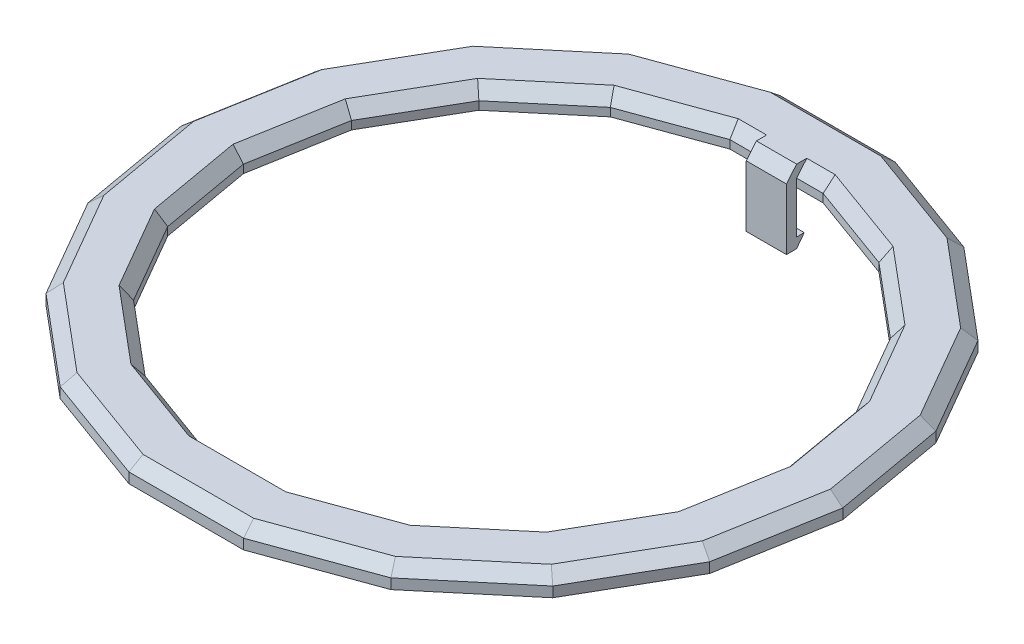
from build123d import *
from OCP.BRepFilletAPI import BRepFilletAPI_MakeChamfer

# Parameters (mm, degrees)
BOSS_EXTRUDE1_DEPTH = 1
BOSS_EXTRUDE3_DEPTH = 4
CUT_EXTRUDE2_DEPTH  = 1
BOSS_EXTRUDE5_DEPTH = 4
SKETCH6_W           = 10.5
SKETCH6_H           = 2
CUT_EXTRUDE3_DEPTH  = 1.25
SKETCH7_W           = 7.9
SKETCH7_H           = 14.4
BOSS_EXTRUDE6_DEPTH = 2
CHAMFER1_SIZE       = 2.383507185
CHAMFER1_SIZE_2     = 2
BOSS_EXTRUDE7_DEPTH = 7.9


with BuildPart() as part:
    # Sketch1 → Boss-Extrude1 (new body)
    with BuildSketch(Plane(origin=(0, 0, 0), x_dir=(1, 0, 0), z_dir=(0, 1, 0))):
        Polygon((62.969146776, 0), (59.171642563, 21.536716606), (48.237164976, 40.47578734), (31.484573388, 54.532880763), (10.934477587, 62.012503946), (-10.934477587, 62.012503946), (-31.484573388, 54.532880763), (-48.237164976, 40.47578734), (-59.171642563, 21.536716606), (-62.969146776, 0), (-59.171642563, -21.536716606), (-48.237164976, -40.47578734), (-31.484573388, -54.532880763), (-10.934477587, -62.012503946), (10.934477587, -62.012503946), (31.484573388, -54.532880763), (48.237164976, -40.47578734), (59.171642563, -21.536716606), align=None)
    extrude(amount=-BOSS_EXTRUDE1_DEPTH)

    # Sketch3 → Cut-Extrude2 (cut)
    with BuildSketch(Plane(origin=(0, 0, 0), x_dir=(1, 0, 0), z_dir=(0, 1, 0))):
        Polygon((54.814880655, 0), (51.509138861, 18.747793338), (41.990634726, 35.234326111), (27.407440327, 47.471079153), (9.518504135, 53.982119449), (-9.518504135, 53.982119449), (-27.407440328, 47.471079153), (-41.990634726, 35.234326111), (-51.509138861, 18.747793338), (-54.814880655, 0), (-51.509138861, -18.747793338), (-41.990634726, -35.234326111), (-27.407440327, -47.471079153), (-9.518504135, -53.982119449), (9.518504135, -53.982119449), (27.407440328, -47.471079153), (41.990634726, -35.234326111), (51.509138861, -18.747793338), align=None)
    extrude(amount=-CUT_EXTRUDE2_DEPTH, mode=Mode.SUBTRACT)


with BuildPart() as body_2:
    # Sketch1<7> → Boss-Extrude3 (new body)
    with BuildSketch(Plane(origin=(0, 0, 0), x_dir=(1, 0, 0), z_dir=(0, 1, 0))):
        Polygon((65, 0), (61.080020351, 22.231309316), (49.792888803, 41.78119463), (32.5, 56.291651246), (11.287131548, 64.012503946), (-11.287131548, 64.012503946), (-32.5, 56.291651246), (-49.792888803, 41.78119463), (-61.080020351, 22.231309316), (-65, 0), (-61.080020351, -22.231309316), (-49.792888803, -41.78119463), (-32.5, -56.291651246), (-11.287131548, -64.012503946), (11.287131548, -64.012503946), (32.5, -56.291651246), (49.792888803, -41.78119463), (61.080020351, -22.231309316), align=None)
        Polygon((62.969146776, 0), (59.171642563, 21.536716606), (48.237164976, 40.47578734), (31.484573388, 54.532880763), (10.934477587, 62.012503946), (-10.934477587, 62.012503946), (-31.484573388, 54.532880763), (-48.237164976, 40.47578734), (-59.171642563, 21.536716606), (-62.969146776, 0), (-59.171642563, -21.536716606), (-48.237164976, -40.47578734), (-31.484573388, -54.532880763), (-10.934477587, -62.012503946), (10.934477587, -62.012503946), (31.484573388, -54.532880763), (48.237164976, -40.47578734), (59.171642563, -21.536716606), align=None, mode=Mode.SUBTRACT)
    extrude(amount=-BOSS_EXTRUDE3_DEPTH)


    add(part.part)  # Boss-Extrude5 merges part
    # Sketch5 → Boss-Extrude5 (add)
    with BuildSketch(Plane(origin=(0, 0, 0), x_dir=(1, 0, 0), z_dir=(0, 1, 0))):
        Polygon((54.814880655, 0), (51.509138861, 18.747793338), (41.990634726, 35.234326111), (27.407440328, 47.471079153), (9.518504135, 53.982119449), (-9.518504135, 53.982119449), (-27.407440328, 47.471079153), (-41.990634726, 35.234326111), (-51.509138861, 18.747793338), (-54.814880655, 0), (-51.509138861, -18.747793338), (-41.990634726, -35.234326111), (-27.407440328, -47.471079153), (-9.518504135, -53.982119449), (9.518504135, -53.982119449), (27.407440328, -47.471079153), (41.990634726, -35.234326111), (51.509138861, -18.747793338), align=None)
        Polygon((52.784027431, 0), (49.600761072, 18.053200627), (40.434910899, 33.928918822), (26.392013716, 45.712308669), (9.165850173, 51.982119449), (-9.165850173, 51.982119449), (-26.392013716, 45.712308669), (-40.434910899, 33.928918822), (-49.600761072, 18.053200627), (-52.784027431, 0), (-49.600761072, -18.053200627), (-40.434910899, -33.928918822), (-26.392013716, -45.712308669), (-9.165850173, -51.982119449), (9.165850173, -51.982119449), (26.392013716, -45.712308669), (40.434910899, -33.928918822), (49.600761072, -18.053200627), align=None, mode=Mode.SUBTRACT)
    extrude(amount=-BOSS_EXTRUDE5_DEPTH)

    # Sketch6 → Cut-Extrude3 (cut)
    with BuildSketch(Plane.XZ.offset(4)):
        with Locations((0, 52.982119449)):
            Rectangle(SKETCH6_W, SKETCH6_H)
    extrude(amount=-CUT_EXTRUDE3_DEPTH, mode=Mode.SUBTRACT)

    # Sketch7 → Boss-Extrude6 (add)
    with BuildSketch(Plane.XY.offset(-51.982119449)):
        with Locations((0, -7.2)):
            Rectangle(SKETCH7_W, SKETCH7_H)
    extrude(amount=BOSS_EXTRUDE6_DEPTH)

    # Chamfer1
    chamfer1_edges_1 = [body_2.edges().sort_by_distance(p)[0] for p in [
        (55.436454577, 0, 32.006251973),
    ]]
    chamfer1_side_1 = [body_2.faces().sort_by_distance(p)[0] for p in [
        (55.401813561, 0, 31.986251973),
    ]]
    chamfer1_edges_2 = [body_2.edges().sort_by_distance(p)[0] for p in [
        (41.146444401, 0, 49.036422938),
    ]]
    chamfer1_side_2 = [body_2.faces().sort_by_distance(p)[0] for p in [
        (41.120732897, 0, 49.00578116),
    ]]
    chamfer1_edges_3 = [body_2.edges().sort_by_distance(p)[0] for p in [
        (21.893565774, 0, 60.152077596),
    ]]
    chamfer1_side_3 = [body_2.faces().sort_by_distance(p)[0] for p in [
        (21.879884968, 0, 60.114489891),
    ]]
    chamfer1_edges_4 = [body_2.edges().sort_by_distance(p)[0] for p in [
        (0, 0, 64.012503946),
    ]]
    chamfer1_side_4 = [body_2.faces().sort_by_distance(p)[0] for p in [
        (0, 0, 63.972503946),
    ]]
    chamfer1_edges_5 = [body_2.edges().sort_by_distance(p)[0] for p in [
        (-21.893565774, 0, 60.152077596),
    ]]
    chamfer1_side_5 = [body_2.faces().sort_by_distance(p)[0] for p in [
        (-21.879884968, 0, 60.114489891),
    ]]
    chamfer1_edges_6 = [body_2.edges().sort_by_distance(p)[0] for p in [
        (-41.146444401, 0, 49.036422938),
    ]]
    chamfer1_side_6 = [body_2.faces().sort_by_distance(p)[0] for p in [
        (-41.120732897, 0, 49.00578116),
    ]]
    chamfer1_edges_7 = [body_2.edges().sort_by_distance(p)[0] for p in [
        (51.192394252, 0, -9.026600314),
    ]]
    chamfer1_side_7 = [body_2.faces().sort_by_distance(p)[0] for p in [
        (51.231786562, 0, -9.033546241),
    ]]
    chamfer1_edges_8 = [body_2.edges().sort_by_distance(p)[0] for p in [
        (45.017835986, 0, -25.991059725),
    ]]
    chamfer1_side_8 = [body_2.faces().sort_by_distance(p)[0] for p in [
        (45.052477002, 0, -26.011059725),
    ]]
    chamfer1_edges_9 = [body_2.edges().sort_by_distance(p)[0] for p in [
        (33.413462307, 0, -39.820613746),
    ]]
    chamfer1_side_9 = [body_2.faces().sort_by_distance(p)[0] for p in [
        (33.439173812, 0, -39.851255524),
    ]]
    chamfer1_edges_10 = [body_2.edges().sort_by_distance(p)[0] for p in [
        (17.778931944, 0, -48.847214059),
    ]]
    chamfer1_side_10 = [body_2.faces().sort_by_distance(p)[0] for p in [
        (17.79261275, 0, -48.884801764),
    ]]
    chamfer1_edges_11 = [body_2.edges().sort_by_distance(p)[0] for p in [
        (6.557925087, 0, -51.982119449),
    ]]
    chamfer1_side_11 = [body_2.faces().sort_by_distance(p)[0] for p in [
        (6.557925087, 0, -52.022119449),
    ]]
    chamfer1_edges_12 = [body_2.edges().sort_by_distance(p)[0] for p in [
        (-17.778931944, 0, -48.847214059),
    ]]
    chamfer1_side_12 = [body_2.faces().sort_by_distance(p)[0] for p in [
        (-17.79261275, 0, -48.884801764),
    ]]
    chamfer1_edges_13 = [body_2.edges().sort_by_distance(p)[0] for p in [
        (-33.413462307, 0, -39.820613746),
    ]]
    chamfer1_side_13 = [body_2.faces().sort_by_distance(p)[0] for p in [
        (-33.439173812, 0, -39.851255524),
    ]]
    chamfer1_edges_14 = [body_2.edges().sort_by_distance(p)[0] for p in [
        (-45.017835986, 0, -25.991059725),
    ]]
    chamfer1_side_14 = [body_2.faces().sort_by_distance(p)[0] for p in [
        (-45.052477002, 0, -26.011059725),
    ]]
    chamfer1_edges_15 = [body_2.edges().sort_by_distance(p)[0] for p in [
        (-51.192394252, 0, -9.026600314),
    ]]
    chamfer1_side_15 = [body_2.faces().sort_by_distance(p)[0] for p in [
        (-51.231786562, 0, -9.033546241),
    ]]
    chamfer1_edges_16 = [body_2.edges().sort_by_distance(p)[0] for p in [
        (-51.192394252, 0, 9.026600314),
    ]]
    chamfer1_side_16 = [body_2.faces().sort_by_distance(p)[0] for p in [
        (-51.231786562, 0, 9.033546241),
    ]]
    chamfer1_edges_17 = [body_2.edges().sort_by_distance(p)[0] for p in [
        (-45.017835986, 0, 25.991059725),
    ]]
    chamfer1_side_17 = [body_2.faces().sort_by_distance(p)[0] for p in [
        (-45.052477002, 0, 26.011059725),
    ]]
    chamfer1_edges_18 = [body_2.edges().sort_by_distance(p)[0] for p in [
        (-33.413462307, 0, 39.820613746),
    ]]
    chamfer1_side_18 = [body_2.faces().sort_by_distance(p)[0] for p in [
        (-33.439173812, 0, 39.851255524),
    ]]
    chamfer1_edges_19 = [body_2.edges().sort_by_distance(p)[0] for p in [
        (-17.778931944, 0, 48.847214059),
    ]]
    chamfer1_side_19 = [body_2.faces().sort_by_distance(p)[0] for p in [
        (-17.79261275, 0, 48.884801764),
    ]]
    chamfer1_edges_20 = [body_2.edges().sort_by_distance(p)[0] for p in [
        (0, 0, 51.982119449),
    ]]
    chamfer1_side_20 = [body_2.faces().sort_by_distance(p)[0] for p in [
        (0, 0, 52.022119449),
    ]]
    chamfer1_edges_21 = [body_2.edges().sort_by_distance(p)[0] for p in [
        (17.778931944, 0, 48.847214059),
    ]]
    chamfer1_side_21 = [body_2.faces().sort_by_distance(p)[0] for p in [
        (17.79261275, 0, 48.884801764),
    ]]
    chamfer1_edges_22 = [body_2.edges().sort_by_distance(p)[0] for p in [
        (33.413462307, 0, 39.820613746),
    ]]
    chamfer1_side_22 = [body_2.faces().sort_by_distance(p)[0] for p in [
        (33.439173812, 0, 39.851255524),
    ]]
    chamfer1_edges_23 = [body_2.edges().sort_by_distance(p)[0] for p in [
        (45.017835986, 0, 25.991059725),
    ]]
    chamfer1_side_23 = [body_2.faces().sort_by_distance(p)[0] for p in [
        (45.052477002, 0, 26.011059725),
    ]]
    chamfer1_edges_24 = [body_2.edges().sort_by_distance(p)[0] for p in [
        (51.192394252, 0, 9.026600314),
    ]]
    chamfer1_side_24 = [body_2.faces().sort_by_distance(p)[0] for p in [
        (51.231786562, 0, 9.033546241),
    ]]
    chamfer1_edges_25 = [body_2.edges().sort_by_distance(p)[0] for p in [
        (-6.557925087, 0, -51.982119449),
    ]]
    chamfer1_side_25 = [body_2.faces().sort_by_distance(p)[0] for p in [
        (-6.557925087, 0, -52.022119449),
    ]]
    chamfer1_edges_26 = [body_2.edges().sort_by_distance(p)[0] for p in [
        (0, 0, -49.982119449),
    ]]
    chamfer1_side_26 = [body_2.faces().sort_by_distance(p)[0] for p in [
        (0, 0, -50.022119449),
    ]]
    chamfer1_edges_27 = [body_2.edges().sort_by_distance(p)[0] for p in [
        (-55.436454577, 0, 32.006251973),
    ]]
    chamfer1_side_27 = [body_2.faces().sort_by_distance(p)[0] for p in [
        (-55.401813561, 0, 31.986251973),
    ]]
    chamfer1_edges_28 = [body_2.edges().sort_by_distance(p)[0] for p in [
        (-63.040010176, 0, 11.115654658),
    ]]
    chamfer1_side_28 = [body_2.faces().sort_by_distance(p)[0] for p in [
        (-63.000617865, 0, 11.108708731),
    ]]
    chamfer1_edges_29 = [body_2.edges().sort_by_distance(p)[0] for p in [
        (-63.040010176, 0, -11.115654658),
    ]]
    chamfer1_side_29 = [body_2.faces().sort_by_distance(p)[0] for p in [
        (-63.000617865, 0, -11.108708731),
    ]]
    chamfer1_edges_30 = [body_2.edges().sort_by_distance(p)[0] for p in [
        (-55.436454577, 0, -32.006251973),
    ]]
    chamfer1_side_30 = [body_2.faces().sort_by_distance(p)[0] for p in [
        (-55.401813561, 0, -31.986251973),
    ]]
    chamfer1_edges_31 = [body_2.edges().sort_by_distance(p)[0] for p in [
        (-41.146444401, 0, -49.036422938),
    ]]
    chamfer1_side_31 = [body_2.faces().sort_by_distance(p)[0] for p in [
        (-41.120732897, 0, -49.00578116),
    ]]
    chamfer1_edges_32 = [body_2.edges().sort_by_distance(p)[0] for p in [
        (-21.893565774, 0, -60.152077596),
    ]]
    chamfer1_side_32 = [body_2.faces().sort_by_distance(p)[0] for p in [
        (-21.879884968, 0, -60.114489891),
    ]]
    chamfer1_edges_33 = [body_2.edges().sort_by_distance(p)[0] for p in [
        (0, 0, -64.012503946),
    ]]
    chamfer1_side_33 = [body_2.faces().sort_by_distance(p)[0] for p in [
        (0, 0, -63.972503946),
    ]]
    chamfer1_edges_34 = [body_2.edges().sort_by_distance(p)[0] for p in [
        (21.893565774, 0, -60.152077596),
    ]]
    chamfer1_side_34 = [body_2.faces().sort_by_distance(p)[0] for p in [
        (21.879884968, 0, -60.114489891),
    ]]
    chamfer1_edges_35 = [body_2.edges().sort_by_distance(p)[0] for p in [
        (41.146444401, 0, -49.036422938),
    ]]
    chamfer1_side_35 = [body_2.faces().sort_by_distance(p)[0] for p in [
        (41.120732897, 0, -49.00578116),
    ]]
    chamfer1_edges_36 = [body_2.edges().sort_by_distance(p)[0] for p in [
        (55.436454577, 0, -32.006251973),
    ]]
    chamfer1_side_36 = [body_2.faces().sort_by_distance(p)[0] for p in [
        (55.401813561, 0, -31.986251973),
    ]]
    chamfer1_edges_37 = [body_2.edges().sort_by_distance(p)[0] for p in [
        (63.040010176, 0, -11.115654658),
    ]]
    chamfer1_side_37 = [body_2.faces().sort_by_distance(p)[0] for p in [
        (63.000617865, 0, -11.108708731),
    ]]
    chamfer1_edges_38 = [body_2.edges().sort_by_distance(p)[0] for p in [
        (63.040010176, 0, 11.115654658),
    ]]
    chamfer1_side_38 = [body_2.faces().sort_by_distance(p)[0] for p in [
        (63.000617865, 0, 11.108708731),
    ]]
    chamfer1 = BRepFilletAPI_MakeChamfer(body_2.part.solid().wrapped)
    for e in chamfer1_edges_1:
        chamfer1.Add(CHAMFER1_SIZE - 0.0001, CHAMFER1_SIZE_2 - 0.0001, e.wrapped, chamfer1_side_1[0].wrapped)
    for e in chamfer1_edges_2:
        chamfer1.Add(CHAMFER1_SIZE - 0.0001, CHAMFER1_SIZE_2 - 0.0001, e.wrapped, chamfer1_side_2[0].wrapped)
    for e in chamfer1_edges_3:
        chamfer1.Add(CHAMFER1_SIZE - 0.0001, CHAMFER1_SIZE_2 - 0.0001, e.wrapped, chamfer1_side_3[0].wrapped)
    for e in chamfer1_edges_4:
        chamfer1.Add(CHAMFER1_SIZE - 0.0001, CHAMFER1_SIZE_2 - 0.0001, e.wrapped, chamfer1_side_4[0].wrapped)
    for e in chamfer1_edges_5:
        chamfer1.Add(CHAMFER1_SIZE - 0.0001, CHAMFER1_SIZE_2 - 0.0001, e.wrapped, chamfer1_side_5[0].wrapped)
    for e in chamfer1_edges_6:
        chamfer1.Add(CHAMFER1_SIZE - 0.0001, CHAMFER1_SIZE_2 - 0.0001, e.wrapped, chamfer1_side_6[0].wrapped)
    for e in chamfer1_edges_7:
        chamfer1.Add(CHAMFER1_SIZE_2 - 0.0001, CHAMFER1_SIZE - 0.0001, e.wrapped, chamfer1_side_7[0].wrapped)
    for e in chamfer1_edges_8:
        chamfer1.Add(CHAMFER1_SIZE_2 - 0.0001, CHAMFER1_SIZE - 0.0001, e.wrapped, chamfer1_side_8[0].wrapped)
    for e in chamfer1_edges_9:
        chamfer1.Add(CHAMFER1_SIZE_2 - 0.0001, CHAMFER1_SIZE - 0.0001, e.wrapped, chamfer1_side_9[0].wrapped)
    for e in chamfer1_edges_10:
        chamfer1.Add(CHAMFER1_SIZE_2 - 0.0001, CHAMFER1_SIZE - 0.0001, e.wrapped, chamfer1_side_10[0].wrapped)
    for e in chamfer1_edges_11:
        chamfer1.Add(CHAMFER1_SIZE_2 - 0.0001, CHAMFER1_SIZE - 0.0001, e.wrapped, chamfer1_side_11[0].wrapped)
    for e in chamfer1_edges_12:
        chamfer1.Add(CHAMFER1_SIZE_2 - 0.0001, CHAMFER1_SIZE - 0.0001, e.wrapped, chamfer1_side_12[0].wrapped)
    for e in chamfer1_edges_13:
        chamfer1.Add(CHAMFER1_SIZE_2 - 0.0001, CHAMFER1_SIZE - 0.0001, e.wrapped, chamfer1_side_13[0].wrapped)
    for e in chamfer1_edges_14:
        chamfer1.Add(CHAMFER1_SIZE_2 - 0.0001, CHAMFER1_SIZE - 0.0001, e.wrapped, chamfer1_side_14[0].wrapped)
    for e in chamfer1_edges_15:
        chamfer1.Add(CHAMFER1_SIZE_2 - 0.0001, CHAMFER1_SIZE - 0.0001, e.wrapped, chamfer1_side_15[0].wrapped)
    for e in chamfer1_edges_16:
        chamfer1.Add(CHAMFER1_SIZE_2 - 0.0001, CHAMFER1_SIZE - 0.0001, e.wrapped, chamfer1_side_16[0].wrapped)
    for e in chamfer1_edges_17:
        chamfer1.Add(CHAMFER1_SIZE_2 - 0.0001, CHAMFER1_SIZE - 0.0001, e.wrapped, chamfer1_side_17[0].wrapped)
    for e in chamfer1_edges_18:
        chamfer1.Add(CHAMFER1_SIZE_2 - 0.0001, CHAMFER1_SIZE - 0.0001, e.wrapped, chamfer1_side_18[0].wrapped)
    for e in chamfer1_edges_19:
        chamfer1.Add(CHAMFER1_SIZE_2 - 0.0001, CHAMFER1_SIZE - 0.0001, e.wrapped, chamfer1_side_19[0].wrapped)
    for e in chamfer1_edges_20:
        chamfer1.Add(CHAMFER1_SIZE_2 - 0.0001, CHAMFER1_SIZE - 0.0001, e.wrapped, chamfer1_side_20[0].wrapped)
    for e in chamfer1_edges_21:
        chamfer1.Add(CHAMFER1_SIZE_2 - 0.0001, CHAMFER1_SIZE - 0.0001, e.wrapped, chamfer1_side_21[0].wrapped)
    for e in chamfer1_edges_22:
        chamfer1.Add(CHAMFER1_SIZE_2 - 0.0001, CHAMFER1_SIZE - 0.0001, e.wrapped, chamfer1_side_22[0].wrapped)
    for e in chamfer1_edges_23:
        chamfer1.Add(CHAMFER1_SIZE_2 - 0.0001, CHAMFER1_SIZE - 0.0001, e.wrapped, chamfer1_side_23[0].wrapped)
    for e in chamfer1_edges_24:
        chamfer1.Add(CHAMFER1_SIZE_2 - 0.0001, CHAMFER1_SIZE - 0.0001, e.wrapped, chamfer1_side_24[0].wrapped)
    for e in chamfer1_edges_25:
        chamfer1.Add(CHAMFER1_SIZE_2 - 0.0001, CHAMFER1_SIZE - 0.0001, e.wrapped, chamfer1_side_25[0].wrapped)
    for e in chamfer1_edges_26:
        chamfer1.Add(CHAMFER1_SIZE_2 - 0.0001, CHAMFER1_SIZE - 0.0001, e.wrapped, chamfer1_side_26[0].wrapped)
    for e in chamfer1_edges_27:
        chamfer1.Add(CHAMFER1_SIZE - 0.0001, CHAMFER1_SIZE_2 - 0.0001, e.wrapped, chamfer1_side_27[0].wrapped)
    for e in chamfer1_edges_28:
        chamfer1.Add(CHAMFER1_SIZE - 0.0001, CHAMFER1_SIZE_2 - 0.0001, e.wrapped, chamfer1_side_28[0].wrapped)
    for e in chamfer1_edges_29:
        chamfer1.Add(CHAMFER1_SIZE - 0.0001, CHAMFER1_SIZE_2 - 0.0001, e.wrapped, chamfer1_side_29[0].wrapped)
    for e in chamfer1_edges_30:
        chamfer1.Add(CHAMFER1_SIZE - 0.0001, CHAMFER1_SIZE_2 - 0.0001, e.wrapped, chamfer1_side_30[0].wrapped)
    for e in chamfer1_edges_31:
        chamfer1.Add(CHAMFER1_SIZE - 0.0001, CHAMFER1_SIZE_2 - 0.0001, e.wrapped, chamfer1_side_31[0].wrapped)
    for e in chamfer1_edges_32:
        chamfer1.Add(CHAMFER1_SIZE - 0.0001, CHAMFER1_SIZE_2 - 0.0001, e.wrapped, chamfer1_side_32[0].wrapped)
    for e in chamfer1_edges_33:
        chamfer1.Add(CHAMFER1_SIZE - 0.0001, CHAMFER1_SIZE_2 - 0.0001, e.wrapped, chamfer1_side_33[0].wrapped)
    for e in chamfer1_edges_34:
        chamfer1.Add(CHAMFER1_SIZE - 0.0001, CHAMFER1_SIZE_2 - 0.0001, e.wrapped, chamfer1_side_34[0].wrapped)
    for e in chamfer1_edges_35:
        chamfer1.Add(CHAMFER1_SIZE - 0.0001, CHAMFER1_SIZE_2 - 0.0001, e.wrapped, chamfer1_side_35[0].wrapped)
    for e in chamfer1_edges_36:
        chamfer1.Add(CHAMFER1_SIZE - 0.0001, CHAMFER1_SIZE_2 - 0.0001, e.wrapped, chamfer1_side_36[0].wrapped)
    for e in chamfer1_edges_37:
        chamfer1.Add(CHAMFER1_SIZE - 0.0001, CHAMFER1_SIZE_2 - 0.0001, e.wrapped, chamfer1_side_37[0].wrapped)
    for e in chamfer1_edges_38:
        chamfer1.Add(CHAMFER1_SIZE - 0.0001, CHAMFER1_SIZE_2 - 0.0001, e.wrapped, chamfer1_side_38[0].wrapped)
    add(Compound.cast(chamfer1.Shape()), mode=Mode.REPLACE)  # a hair under: the kernel refuses the full size

    # Sketch9 → Boss-Extrude7 (add)
    with BuildSketch(Plane.ZY.offset(3.95)):
        Polygon((-51.982119449, -14.4), (-53.482119449, -12.4), (-51.982119449, -12.4), align=None)
    extrude(amount=-BOSS_EXTRUDE7_DEPTH)


solid = body_2.part
